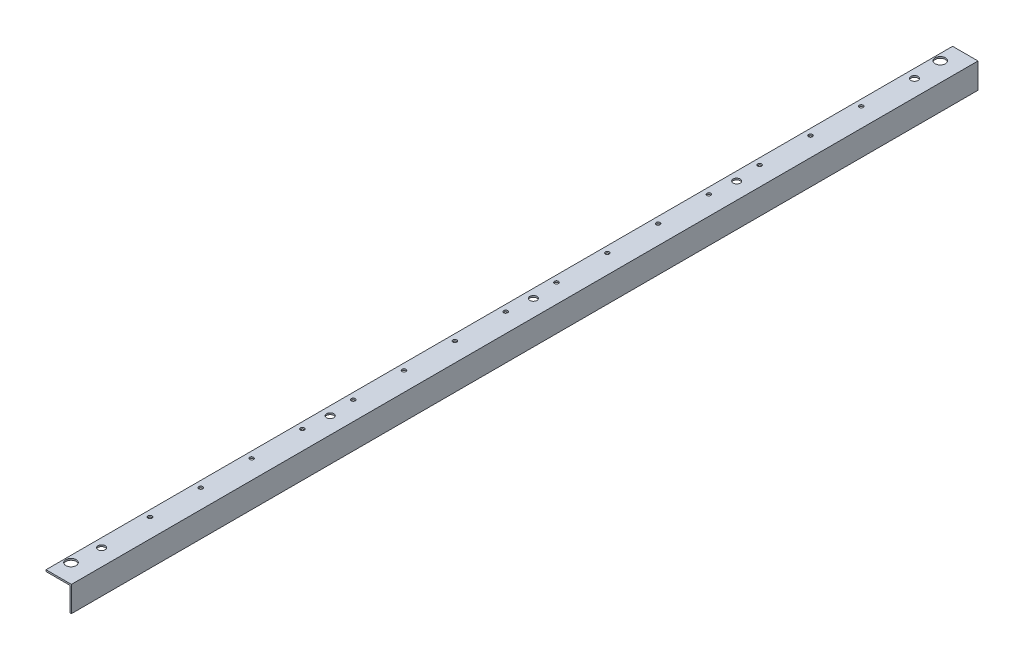
from build123d import *

# Parameters (mm, degrees)
BOSS_EXTRUDE1_DEPTH = 1812.925
SKETCH2_R           = 10.31875
SKETCH2_R_2         = 7.14375
CUT_EXTRUDE1_DEPTH  = 1815.347909202
SKETCH4_R           = 3.96875
CUT_EXTRUDE3_DEPTH  = 44.45
LPATTERN1_COUNT     = 15
LPATTERN1_PITCH     = 101.6


with BuildPart() as part:
    # Sketch1 → Boss-Extrude1 (new body)
    with BuildSketch(Plane.XY):
        Polygon((0, 0), (-50.8, 0), (-50.8, -3.175), (-3.175, -3.175), (-3.175, -50.8), (0, -50.8), align=None)
    extrude(amount=BOSS_EXTRUDE1_DEPTH)

    # Sketch2 → Cut-Extrude1 (cut, through all)
    with BuildSketch(Plane(origin=(0, 0, 0), x_dir=(1, 0, 0), z_dir=(0, 1, 0))):
        with Locations((-38.1, -37.30625)):
            Circle(SKETCH2_R)
        with Locations((-38.1, -1775.61875)):
            Circle(SKETCH2_R)
        with Locations((-33.3375, -93.6625)):
            Circle(SKETCH2_R_2)
        with Locations((-33.3375, -449.2625)):
            Circle(SKETCH2_R_2)
        with Locations((-33.3375, -855.6625)):
            Circle(SKETCH2_R_2)
        with Locations((-33.3375, -1262.0625)):
            Circle(SKETCH2_R_2)
        with Locations((-33.3375, -1719.2625)):
            Circle(SKETCH2_R_2)
    extrude(amount=-CUT_EXTRUDE1_DEPTH, mode=Mode.SUBTRACT)

    # Sketch4 → Cut-Extrude3 (cut)
    with BuildSketch(Plane(origin=(-2.029899632, 0, 893.163272881), x_dir=(1, 0, 0), z_dir=(0, 1, 0))):
        with Locations((-36.070100368, 697.900772881)):
            Circle(SKETCH4_R)
    cut_extrude3 = extrude(amount=-CUT_EXTRUDE3_DEPTH, mode=Mode.SUBTRACT)

    # LPattern1: Cut-Extrude3 ×15
    with Locations(*[(0, 0, i * LPATTERN1_PITCH) for i in range(1, LPATTERN1_COUNT)]):
        add(cut_extrude3, mode=Mode.SUBTRACT)


solid = part.part
